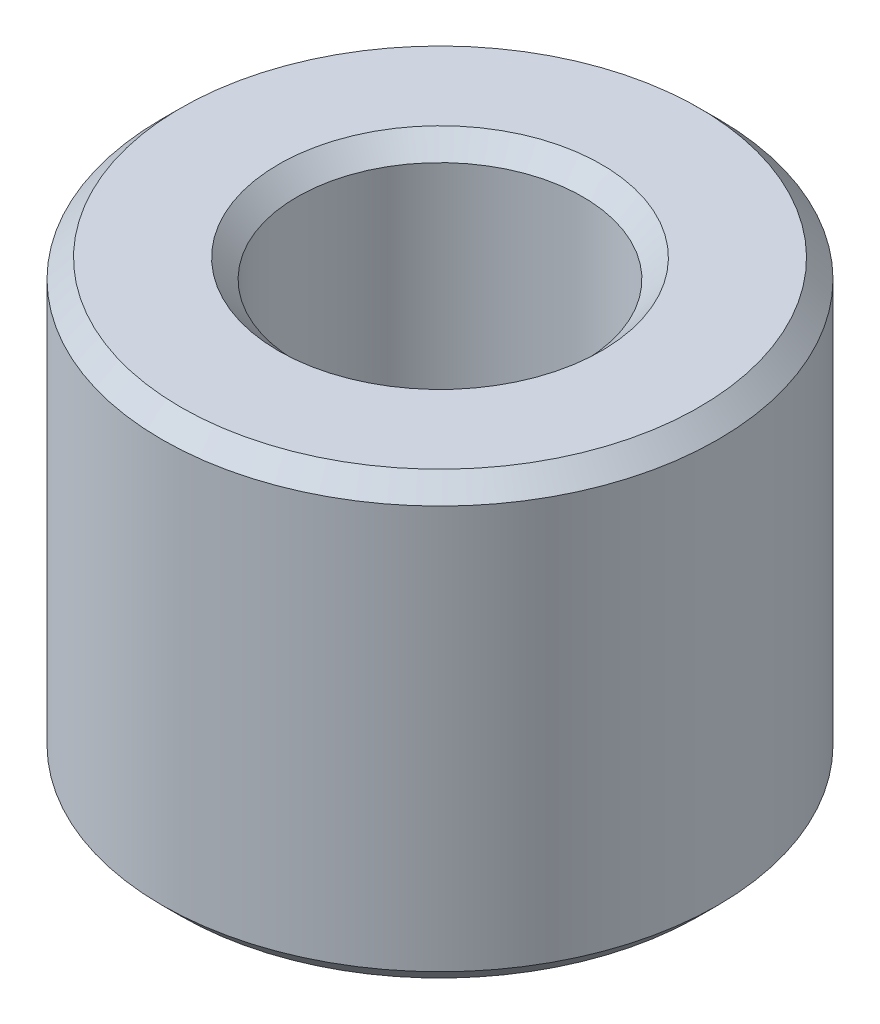
from build123d import *

# Parameters (mm, degrees)
SKETCH1_R           = 32.5
BOSS_EXTRUDE1_DEPTH = 51.538585037
SKETCH2_R           = 16.701108929
CUT_EXTRUDE1_DEPTH  = 70.055960985
CHAMFER1_SIZE       = 2.189622527


with BuildPart() as part:
    # Sketch1 → Boss-Extrude1 (new body)
    with BuildSketch(Plane(origin=(0, 0, 0), x_dir=(1, 0, 0), z_dir=(0, 1, 0))):
        Circle(SKETCH1_R)
    extrude(amount=BOSS_EXTRUDE1_DEPTH)

    # Sketch2 → Cut-Extrude1 (cut, through all)
    with BuildSketch(Plane(origin=(0, 0, 0), x_dir=(1, 0, 0), z_dir=(0, 1, 0))):
        Circle(SKETCH2_R)
    extrude(amount=CUT_EXTRUDE1_DEPTH, mode=Mode.SUBTRACT)

    # Chamfer1
    chamfer1_edges = [part.edges().sort_by_distance(p)[0] for p in [
        (-16.701108929, 51.538585037, 0),
        (-16.701108929, 0, 0),
        (-32.5, 0, 0),
        (-32.5, 51.538585037, 0),
    ]]
    chamfer(chamfer1_edges, length=CHAMFER1_SIZE)


solid = part.part
